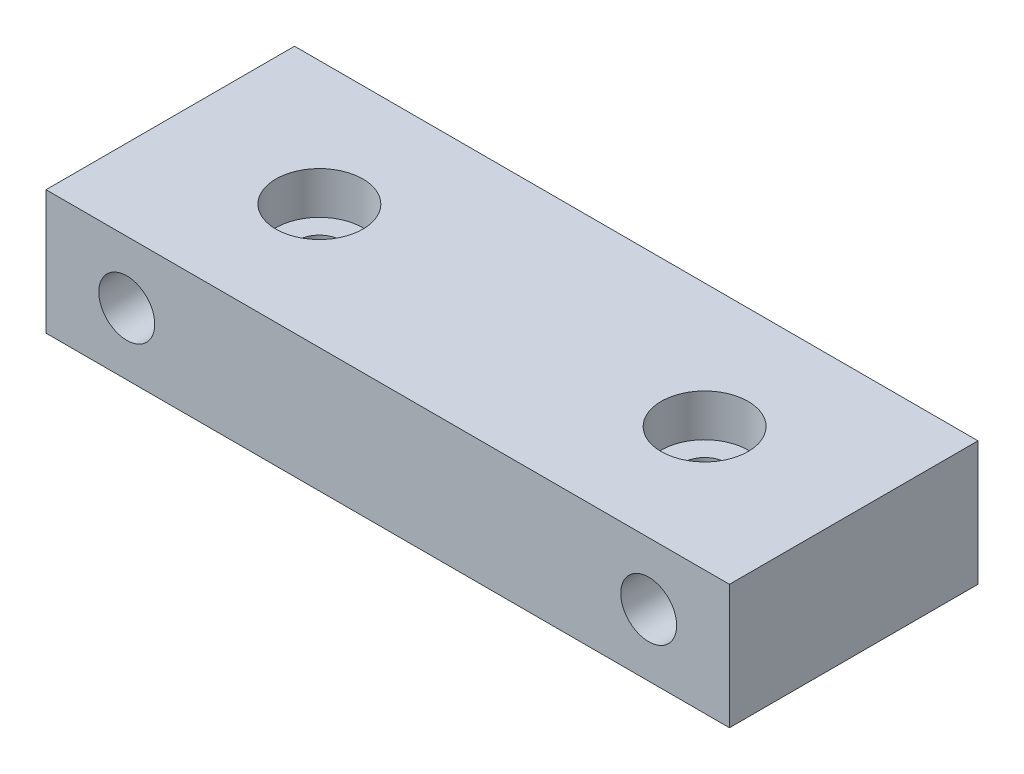
from build123d import *

# Parameters (mm, degrees)
SKETCH1_W                                           = 55
SKETCH1_H                                           = 20
BOSS_EXTRUDE1_DEPTH                                 = 10
SKETCH2_R                                           = 2.25
CUT_EXTRUDE1_DEPTH                                  = 36.443617197
SKETCH3_R                                           = 1.75
CUT_EXTRUDE2_DEPTH                                  = 31.923292192
CBORE_FOR_M3_HEX_SOCKET_HEAD_CAP_SCREW1_D           = 3.4
CBORE_FOR_M3_HEX_SOCKET_HEAD_CAP_SCREW1_CBORE_D     = 7
CBORE_FOR_M3_HEX_SOCKET_HEAD_CAP_SCREW1_CBORE_DEPTH = 3.4
CUT_EXTRUDE3_DEPTH                                  = 4


with BuildPart() as part:
    # Sketch1 → Boss-Extrude1 (new body)
    with BuildSketch(Plane(origin=(0, 0, 0), x_dir=(1, 0, 0), z_dir=(0, 1, 0))):
        Rectangle(SKETCH1_W, SKETCH1_H)
    extrude(amount=BOSS_EXTRUDE1_DEPTH)

    # Sketch2 → Cut-Extrude1 (cut, through all)
    with BuildSketch(Plane.XY.offset(10)):
        with Locations((-21, 5)):
            Circle(SKETCH2_R)
        with Locations((21, 5)):
            Circle(SKETCH2_R)
    extrude(amount=-CUT_EXTRUDE1_DEPTH, mode=Mode.SUBTRACT)

    # Sketch3 → Cut-Extrude2 (cut, through all)
    with BuildSketch(Plane(origin=(0, 10, 0), x_dir=(1, 0, 0), z_dir=(0, 1, 0))):
        with Locations((-15.5, 0)):
            Circle(SKETCH3_R)
        with Locations((15.5, 0)):
            Circle(SKETCH3_R)
    extrude(amount=-CUT_EXTRUDE2_DEPTH, mode=Mode.SUBTRACT)

    # CBORE for M3 Hex Socket Head Cap Screw1 (through all)
    with Locations(Plane(origin=(0, 10, 0), x_dir=(1, 0, 0), z_dir=(0, 1, 0))):
        with Locations((-15.5, 0), (15.5, 0)):
            CounterBoreHole(CBORE_FOR_M3_HEX_SOCKET_HEAD_CAP_SCREW1_D / 2, CBORE_FOR_M3_HEX_SOCKET_HEAD_CAP_SCREW1_CBORE_D / 2, CBORE_FOR_M3_HEX_SOCKET_HEAD_CAP_SCREW1_CBORE_DEPTH)

    # Sketch6 → Cut-Extrude3 (cut)
    with BuildSketch(Plane(origin=(0, 0, -10), x_dir=(-1, 0, 0), z_dir=(0, 0, -1))):
        Polygon((-16.727608008, 5), (-18.863804004, 8.7), (-23.136195996, 8.7), (-25.272391992, 5), (-23.136195996, 1.3), (-18.863804004, 1.3), align=None)
        Polygon((16.727608008, 5), (18.863804004, 1.3), (23.136195996, 1.3), (25.272391992, 5), (23.136195996, 8.7), (18.863804004, 8.7), align=None)
    extrude(amount=-CUT_EXTRUDE3_DEPTH, mode=Mode.SUBTRACT)


solid = part.part
